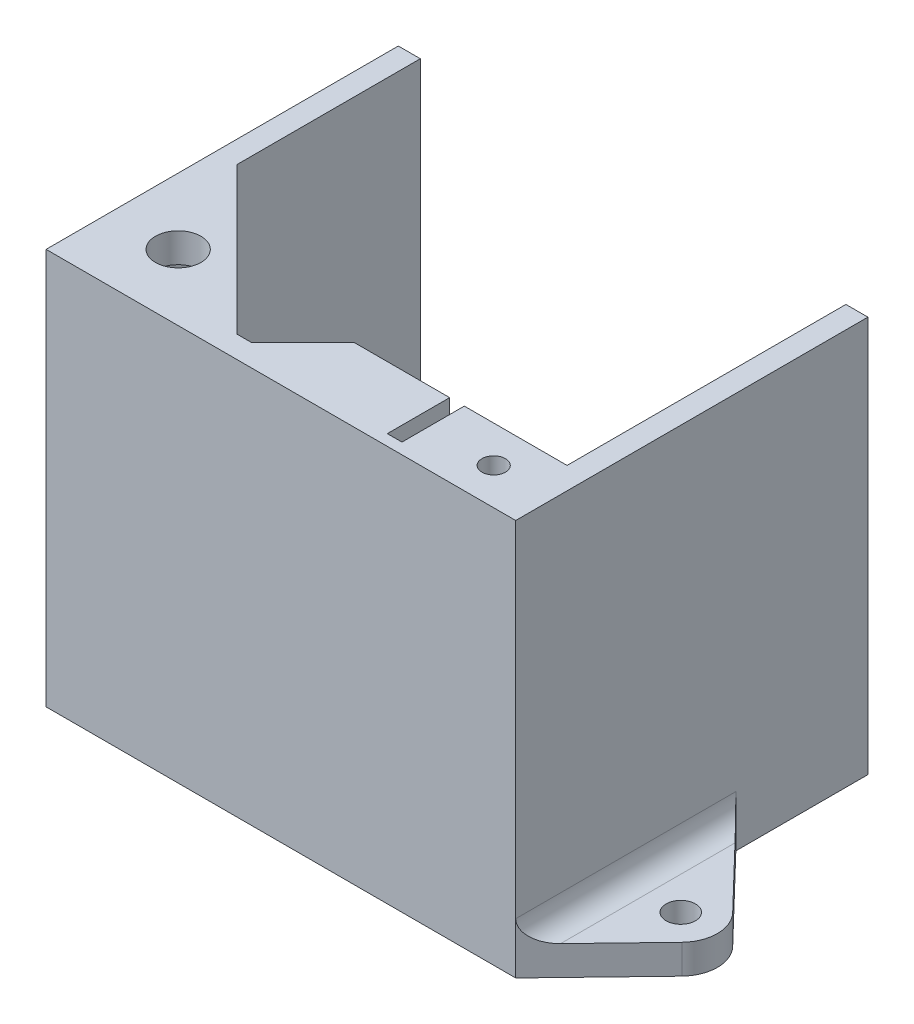
from build123d import *

# Parameters (mm, degrees)
SKETCH1_W           = 64
SKETCH1_H           = 48
BOSS_EXTRUDE1_DEPTH = 4
CUT_EXTRUDE1_DEPTH  = 2.4
CUT_EXTRUDE2_DEPTH  = 2.4
BOSS_EXTRUDE3_DEPTH = 50
BOSS_EXTRUDE4_DEPTH = 50
CUT_EXTRUDE4_DEPTH  = 9.5
SKETCH13_W          = 36.946258726
SKETCH13_H          = 1
CUT_EXTRUDE6_DEPTH  = 32
SKETCH15_R          = 3.1
BOSS_EXTRUDE5_DEPTH = 4
CUT_EXTRUDE7_DEPTH  = 7
SKETCH18_W          = 5.6
SKETCH18_H          = 2.5
CUT_EXTRUDE8_DEPTH  = 5
SKETCH19_W          = 6.595396426
SKETCH19_H          = 7.197552374
SKETCH19_R          = 1.6
BOSS_EXTRUDE8_DEPTH = 4.5
FILLET1_R           = 1.5
SKETCH20_R          = 2
BOSS_EXTRUDE9_DEPTH = 4
FILLET2_R           = 3


with BuildPart() as part:
    # Sketch1 → Boss-Extrude1 (new body)
    with BuildSketch(Plane(origin=(0, 0, 0), x_dir=(1, 0, 0), z_dir=(0, 1, 0))):
        Rectangle(SKETCH1_W, SKETCH1_H)
    extrude(amount=BOSS_EXTRUDE1_DEPTH)

    # Sketch2 → Cut-Extrude1 (cut)
    with BuildSketch(Plane.XZ):
        Polygon((-20.824573519, -16), (-22.41228676, -13.25), (-25.58771324, -13.25), (-27.175426481, -16), (-25.58771324, -18.75), (-22.41228676, -18.75), align=None)
    extrude(amount=-CUT_EXTRUDE1_DEPTH, mode=Mode.SUBTRACT)

    # Sketch4 → Cut-Extrude2 (cut)
    with BuildSketch(Plane.XZ):
        Polygon((9.175426481, 10), (7.58771324, 12.75), (4.41228676, 12.75), (2.824573519, 10), (4.41228676, 7.25), (7.58771324, 7.25), align=None)
    extrude(amount=-CUT_EXTRUDE2_DEPTH, mode=Mode.SUBTRACT)

    # Sketch6 → Boss-Extrude3 (add)
    with BuildSketch(Plane(origin=(0, 4, 0), x_dir=(1, 0, 0), z_dir=(0, 1, 0))):
        Polygon((-29, -21), (-29, 21), (-29, 24), (-32, 24), (-32, -24), (32, -24), (32, 24), (29, 24), (29, 21), (29, -21), align=None)
    extrude(amount=BOSS_EXTRUDE3_DEPTH)

    # Sketch9 → Boss-Extrude4 (add)
    with BuildSketch(Plane(origin=(0, 4, 0), x_dir=(1, 0, 0), z_dir=(0, 1, 0))):
        Polygon((29, -13), (1, -13), (-7, -21), (29, -21), align=None)
    extrude(amount=BOSS_EXTRUDE4_DEPTH)

    # Sketch10 → Cut-Extrude4 (cut)
    with BuildSketch(Plane(origin=(0, 0, 13), x_dir=(-1, 0, 0), z_dir=(0, 0, -1))):
        Polygon((-14.998616503, 39), (-27, 39), (-27, 13), (-1, 13), (-1, 39), (-13.001383497, 39), (-13.001383497, 54), (-14.998616503, 54), align=None)
    extrude(amount=-CUT_EXTRUDE4_DEPTH, mode=Mode.SUBTRACT)

    # Sketch13 → Cut-Extrude6 (cut)
    with BuildSketch(Plane(origin=(0, 54, 0), x_dir=(1, 0, 0), z_dir=(0, 1, 0))):
        with Locations((10.526870637, -13.5)):
            Rectangle(SKETCH13_W, SKETCH13_H)
    extrude(amount=-CUT_EXTRUDE6_DEPTH, mode=Mode.SUBTRACT)

    # Sketch15 → Boss-Extrude5 (add)
    with BuildSketch(Plane(origin=(0, 54, 0), x_dir=(1, 0, 0), z_dir=(0, 1, 0))):
        Polygon((-29, -1), (-9, -21), (-29, -21), align=None)
        with Locations((-23, -15)):
            Circle(SKETCH15_R, mode=Mode.SUBTRACT)
    extrude(amount=-BOSS_EXTRUDE5_DEPTH)

    # Sketch17 → Cut-Extrude7 (cut)
    with BuildSketch(Plane(origin=(0, 54, 0), x_dir=(1, 0, 0), z_dir=(0, 1, 0))):
        Polygon((24, -15.824573519), (21.25, -17.41228676), (21.25, -20.58771324), (24, -22.175426481), (26.75, -20.58771324), (26.75, -17.41228676), align=None)
    extrude(amount=-CUT_EXTRUDE7_DEPTH, mode=Mode.SUBTRACT)

    # Sketch18 → Cut-Extrude8 (cut)
    with BuildSketch(Plane(origin=(0, 0, 14), x_dir=(-1, 0, 0), z_dir=(0, 0, -1))):
        with Locations((-24, 48.25)):
            Rectangle(SKETCH18_W, SKETCH18_H)
    extrude(amount=-CUT_EXTRUDE8_DEPTH, mode=Mode.SUBTRACT)

    # Sketch19 → Boss-Extrude8 (add)
    with BuildSketch(Plane(origin=(0, 54, 0), x_dir=(1, 0, 0), z_dir=(0, 1, 0))):
        with Locations((24, -19)):
            Rectangle(SKETCH19_W, SKETCH19_H)
        with Locations((24, -19)):
            Circle(SKETCH19_R, mode=Mode.SUBTRACT)
    extrude(amount=-BOSS_EXTRUDE8_DEPTH)

    # Fillet1
    fillet1_edges = [part.edges().sort_by_distance(p)[0] for p in [
        (-29, 50, 11),
        (-19, 50, 21),
    ]]
    fillet(fillet1_edges, radius=FILLET1_R)

    # Sketch20 → Boss-Extrude9 (add)
    # profile 1 of 2: a face of its own
    with BuildSketch(Plane.XZ):
        with BuildLine():
            Line((43.102082828, 12.467708073), (32.000000003, 23.999999995))
            Line((32.000000003, 23.999999995), (32, -6.000000006))
            Line((32, -6.000000006), (43.102082826, 5.532291913))
            ThreePointArc((43.102082826, 5.532291913), (44.500000003, 8.999999993), (43.102082828, 12.467708073))
        make_face()
        with Locations((39.500000002, 8.999999994)):
            Circle(SKETCH20_R, mode=Mode.SUBTRACT)
    # profile 2 of 2: a face of its own
    with BuildSketch(Plane.XZ):
        with BuildLine():
            Line((-32, -24), (-32, 2.000000002))
            Line((-32, 2.000000002), (-42.978939192, -7.408763151))
            ThreePointArc((-42.978939192, -7.408763151), (-44.499999999, -10.999999999), (-42.978939192, -14.591236846))
            Line((-42.978939192, -14.591236846), (-32, -24))
        make_face()
        with Locations((-39.499999999, -10.999999999)):
            Circle(SKETCH20_R, mode=Mode.SUBTRACT)
    extrude(amount=-BOSS_EXTRUDE9_DEPTH)

    # Fillet2
    fillet2_edges = [part.edges().sort_by_distance(p)[0] for p in [
        (-32, 4, -10.999999999),
        (32.000000002, 4, 8.999999995),
    ]]
    fillet(fillet2_edges, radius=FILLET2_R)


solid = part.part
